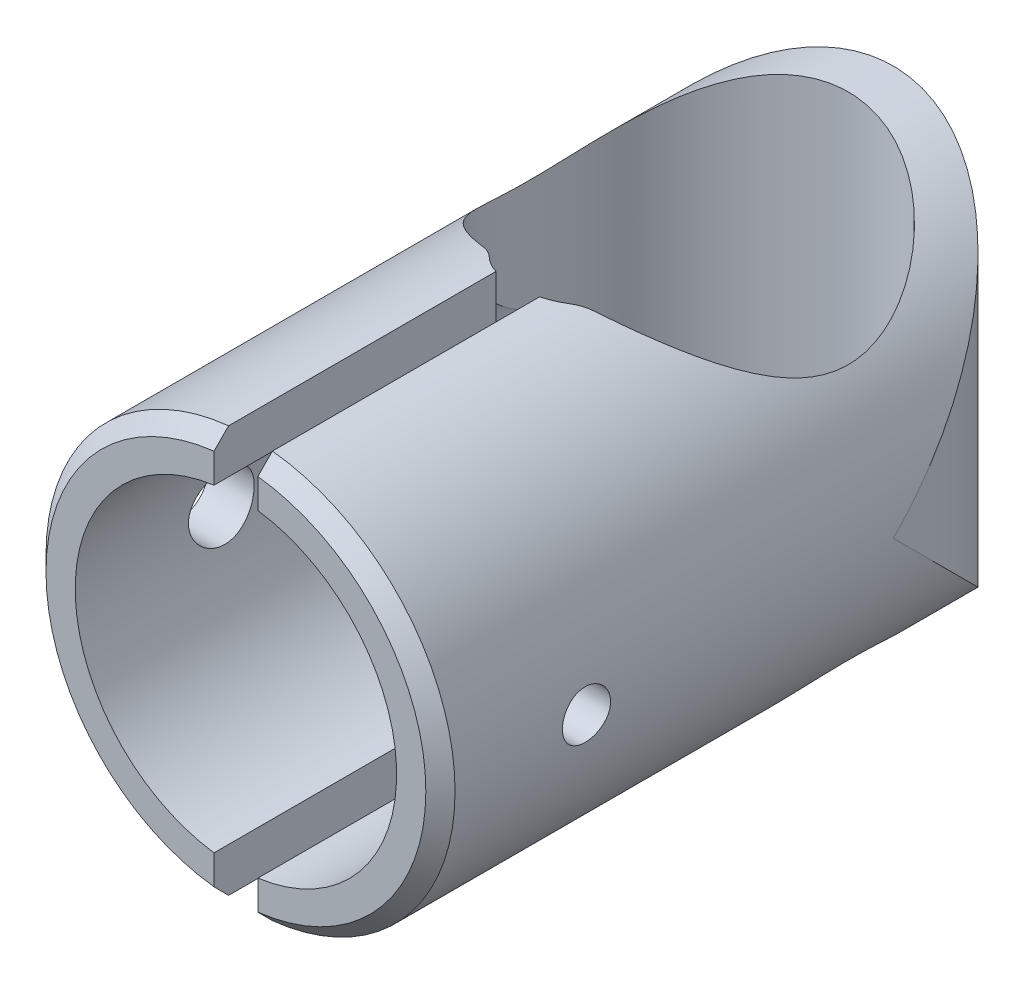
from build123d import *

# Parameters (mm, degrees)
SKETCH_1_R            = 14
EXTRUDE_1_DEPTH       = 45
CUT_EXTRUDE_1_DEPTH   = 55.817880295
CUT_EXTRUDE_2_DEPTH   = 55.817880456
SKETCH_5_R            = 11
CUT_EXTRUDE_3_DEPTH   = 31
HOLE_WIZARD_M41_D     = 4.5
HOLE_WIZARD_M41_DEPTH = 5
HOLE_WIZARD_M41_TIP   = 1.351936393
SKETCH_10_R           = 4
CUT_EXTRUDE_5_DEPTH   = 55.817880456
FILLET_2_R            = 3
M4X0_71_D             = 3.3
M4X0_71_DEPTH         = 11.5
M4X0_71_TIP           = 0.991420021
CHAMFER_1_SIZE        = 1


with BuildPart() as part:
    # Эскиз1 → Бобышка-Вытянуть1 (new body)
    with BuildSketch(Plane.XY):
        with Locations(Location((0, 0, 0), (0, 0, 180))):
            Circle(SKETCH_1_R)
    extrude(amount=EXTRUDE_1_DEPTH)

    # Эскиз2 → Вырез-Вытянуть1 (cut, through all)
    with BuildSketch(Plane(origin=(0, 14, 0), x_dir=(1, 0, 0), z_dir=(0, 1, 0))):
        with BuildLine():
            Line((-1.5, -24.821535242), (-1.5, -45))
            Line((-1.5, -45), (1.5, -45))
            Line((1.5, -45), (1.5, -24.821535242))
            ThreePointArc((1.5, -24.821535242), (0, -3.075), (-1.5, -24.821535242))
        make_face()
    extrude(amount=-CUT_EXTRUDE_1_DEPTH, mode=Mode.SUBTRACT)

    # Эскиз3 → Вырез-Вытянуть2 (cut, through all)
    with BuildSketch(Plane(origin=(0, 14, 0), x_dir=(1, 0, 0), z_dir=(0, 1, 0))):
        with BuildLine():
            Line((0, 0), (14, 0))
            Line((14, 0), (14, -14))
            ThreePointArc((14, -14), (9.899494937, -4.100505063), (0, 0))
        make_face()
    cut_extrude_2 = extrude(amount=-CUT_EXTRUDE_2_DEPTH, mode=Mode.SUBTRACT)

    # Зеркальное отражение1: Вырез-Вытянуть2 across plane
    add(cut_extrude_2.mirror(Plane(origin=(0, 0, 0), x_dir=(0, 0, 1), z_dir=(1, 0, 0))), mode=Mode.SUBTRACT)

    # Эскиз5 → Вырез-Вытянуть3 (cut)
    with BuildSketch(Plane.XY.offset(45)):
        Circle(SKETCH_5_R)
    extrude(amount=-CUT_EXTRUDE_3_DEPTH, mode=Mode.SUBTRACT)

    # Отверстие с зазором M41
    with Locations(Plane.ZY.offset(14)):
        with Locations((35, 0)):
            Hole(HOLE_WIZARD_M41_D / 2, depth=HOLE_WIZARD_M41_DEPTH)
            with Locations((0, 0, -(HOLE_WIZARD_M41_DEPTH + HOLE_WIZARD_M41_TIP / 2))):  # 118° drill point
                Cone(0, HOLE_WIZARD_M41_D / 2, HOLE_WIZARD_M41_TIP, mode=Mode.SUBTRACT)

    # Эскиз10 → Вырез-Вытянуть5 (cut, through all)
    with BuildSketch(Plane(origin=(0, 14, 0), x_dir=(1, 0, 0), z_dir=(0, 1, 0))):
        with Locations((0, -22)):
            Circle(SKETCH_10_R)
    extrude(amount=-CUT_EXTRUDE_5_DEPTH, mode=Mode.SUBTRACT)

    # Скругление2
    # the kernel refuses this fillet: 3 mm, written as the material it takes off along each edge
    with BuildSketch(Plane(origin=(-3.154321676, -15.336704912, 24.459726563), x_dir=(-0.947982144759989, 0, -0.31832350402735166), z_dir=(0, 1, 0))) as fillet_2_piece_1:
        with BuildLine():
            CenterArc((0.771853926, 2.998552517), FILLET_2_R, 244.812204915, 23.407872095)
            ThreePointArc((-0.504905692, 0.283799328), (-0.247309336, 0.151050453), (0, 0))
            ThreePointArc((0, 0), (0.339336183, 0.005271251), (0.678672365, 0))
        make_face()
    extrude(amount=6.495347387, mode=Mode.SUBTRACT)
    with BuildSketch(Plane(origin=(-3.154321676, 8.841357525, 24.459726563), x_dir=(0.6704110172939106, 0, 0.7419899378636773), z_dir=(0, 1, 0))) as fillet_2_piece_2:
        with BuildLine():
            CenterArc((0.796399023, -2.992127049), FILLET_2_R, 94.151841899, 23.407872095)
            ThreePointArc((-0.591619408, -0.332539705), (-0.293226867, -0.170864963), (0, 0))
            ThreePointArc((0, 0), (0.289599645, -0.010497268), (0.579199289, 0))
        make_face()
    extrude(amount=6.495347387, mode=Mode.SUBTRACT)
    with BuildSketch(Plane(origin=(3.154321676, 8.841357557, 24.459726563), x_dir=(0.9479821447599884, 0, -0.31832350402735343), z_dir=(0, 1, 0))) as fillet_2_piece_3:
        with BuildLine():
            CenterArc((0.771853926, -2.998552517), FILLET_2_R, 91.77992299, 23.407872095)
            ThreePointArc((-0.504905692, -0.283799328), (-0.247309336, -0.151050453), (0, 0))
            ThreePointArc((0, 0), (0.339336183, -0.005271251), (0.678672365, 0))
        make_face()
    extrude(amount=6.495347355, mode=Mode.SUBTRACT)
    with BuildSketch(Plane(origin=(3.154321676, -15.336704912, 24.459726563), x_dir=(0.9479821447599884, 0, -0.31832350402735343), z_dir=(0, 1, 0))) as fillet_2_piece_4:
        with BuildLine():
            CenterArc((0.771853926, -2.998552517), FILLET_2_R, 91.77992299, 23.407872095)
            ThreePointArc((-0.504905692, -0.283799328), (-0.247309336, -0.151050453), (0, 0))
            ThreePointArc((0, 0), (0.339336183, -0.005271251), (0.678672365, 0))
        make_face()
    extrude(amount=6.495347356, mode=Mode.SUBTRACT)

    # Отверстие обработанное метчиком M4x0.71
    with Locations(Plane(origin=(14, 0, 0), x_dir=(0, 0, -1), z_dir=(1, 0, 0))):
        with Locations((-35, 0)):
            Hole(M4X0_71_D / 2, depth=M4X0_71_DEPTH)
            with Locations((0, 0, -(M4X0_71_DEPTH + M4X0_71_TIP / 2))):  # 118° drill point
                Cone(0, M4X0_71_D / 2, M4X0_71_TIP, mode=Mode.SUBTRACT)

    # Фаска1
    chamfer_1_edges = [part.edges().sort_by_distance(p)[0] for p in [
        (-10.416333328, 9.354143467, 45),
        (14, 0, 45),
    ]]
    chamfer(chamfer_1_edges, length=CHAMFER_1_SIZE)


solid = part.part
